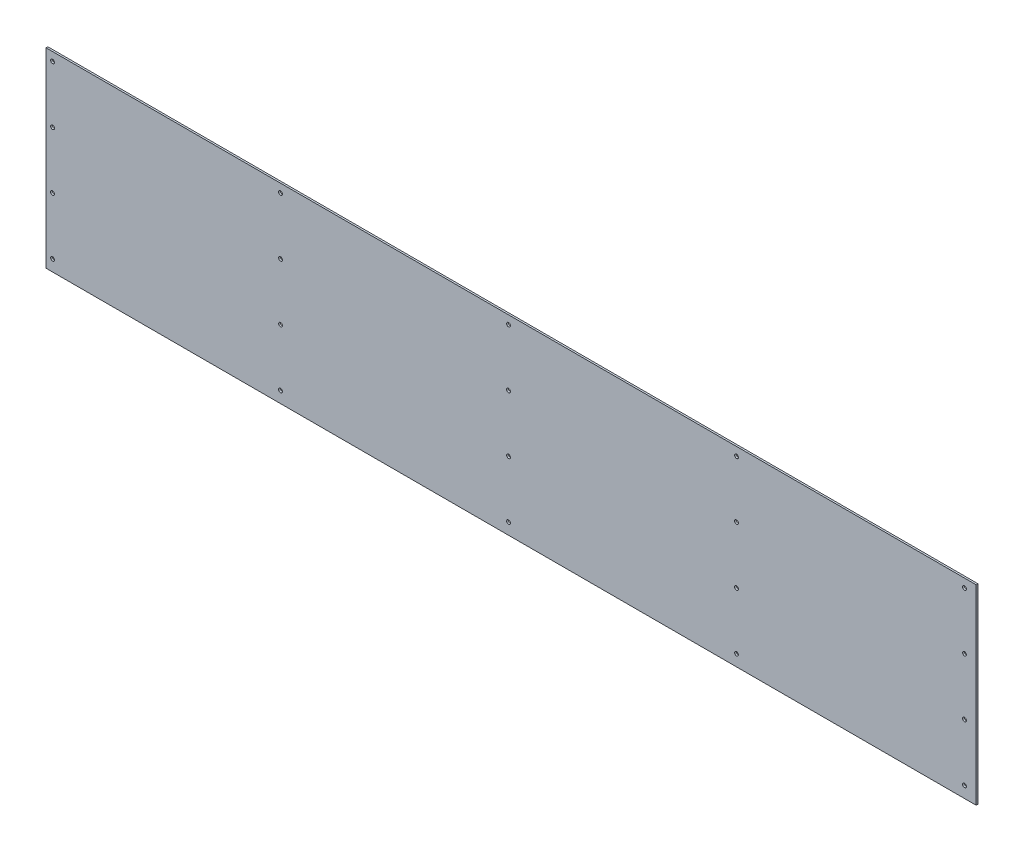
from build123d import *

# Parameters (mm, degrees)
CROQUIS1_W                    = 1632
CROQUIS1_H                    = 335
BRIDA_BASE1_DEPTH             = 3.175
TALADRO_DE_MARGEN_PARA_1_41_D = 6.7564


# Sheet-metal steps are written as plain solids
with BuildPart() as part:
    # Croquis1 → Brida base1 (new body)
    with BuildSketch(Plane.XY):
        with Locations((489.194067834, 0.565878378)):
            Rectangle(CROQUIS1_W, CROQUIS1_H)
    extrude(amount=-BRIDA_BASE1_DEPTH)

    # Taladro de margen para 1/41 (through all)
    with Locations(Plane.XY):
        with Locations((1284.694067834, 153.065878378), (884.694067834, 153.065878378), (484.694067834, 153.065878378), (84.694067834, 153.065878378), (-315.305932166, 153.065878378), (884.694067834, 53.065878378), (484.694067834, 53.065878378), (84.694067834, 53.065878378), (-315.305932166, 53.065878378), (884.694067834, -46.934121622), (484.694067834, -46.934121622), (84.694067834, -46.934121622), (-315.305932166, -46.934121622), (884.694067834, -146.934121622), (484.694067834, -146.934121622), (84.694067834, -146.934121622), (-315.305932166, -146.934121622), (1284.694067834, 53.065878378), (1284.694067834, -46.934121622), (1284.694067834, -146.934121622)):
            Hole(TALADRO_DE_MARGEN_PARA_1_41_D / 2)


solid = part.part
